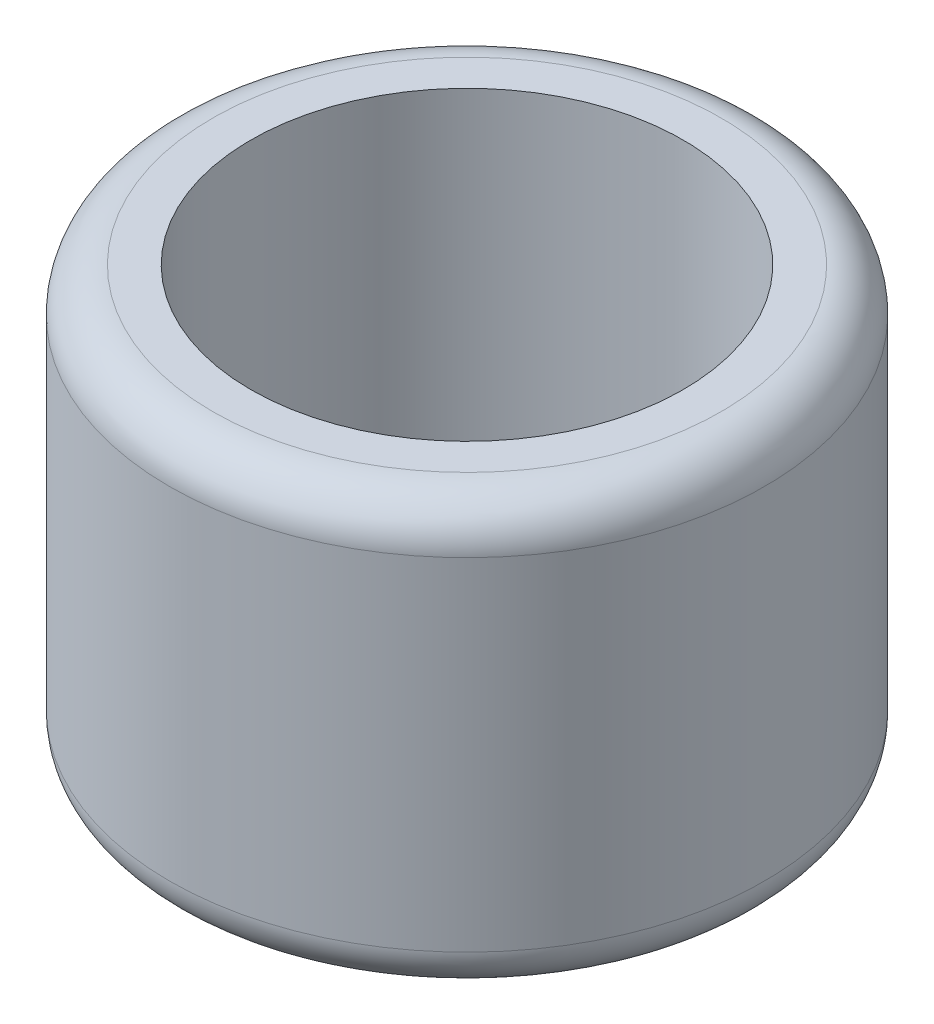
from build123d import *

# Parameters (mm, degrees)
SKETCH1_R           = 8.7376
SKETCH1_R_2         = 6.35
BOSS_EXTRUDE1_DEPTH = 6.2865
FILLET1_R           = 1.27


with BuildPart() as part:
    # Sketch1 → Boss-Extrude1 (new, symmetric)
    with BuildSketch(Plane(origin=(0, 0, 0), x_dir=(1, 0, 0), z_dir=(0, 1, 0))):
        Circle(SKETCH1_R)
        Circle(SKETCH1_R_2, mode=Mode.SUBTRACT)
    extrude(amount=BOSS_EXTRUDE1_DEPTH, both=True)

    # Fillet1
    fillet1_edges = [part.edges().sort_by_distance(p)[0] for p in [
        (-8.7376, -6.2865, 0),
        (-8.7376, 6.2865, 0),
    ]]
    fillet(fillet1_edges, radius=FILLET1_R)


solid = part.part
